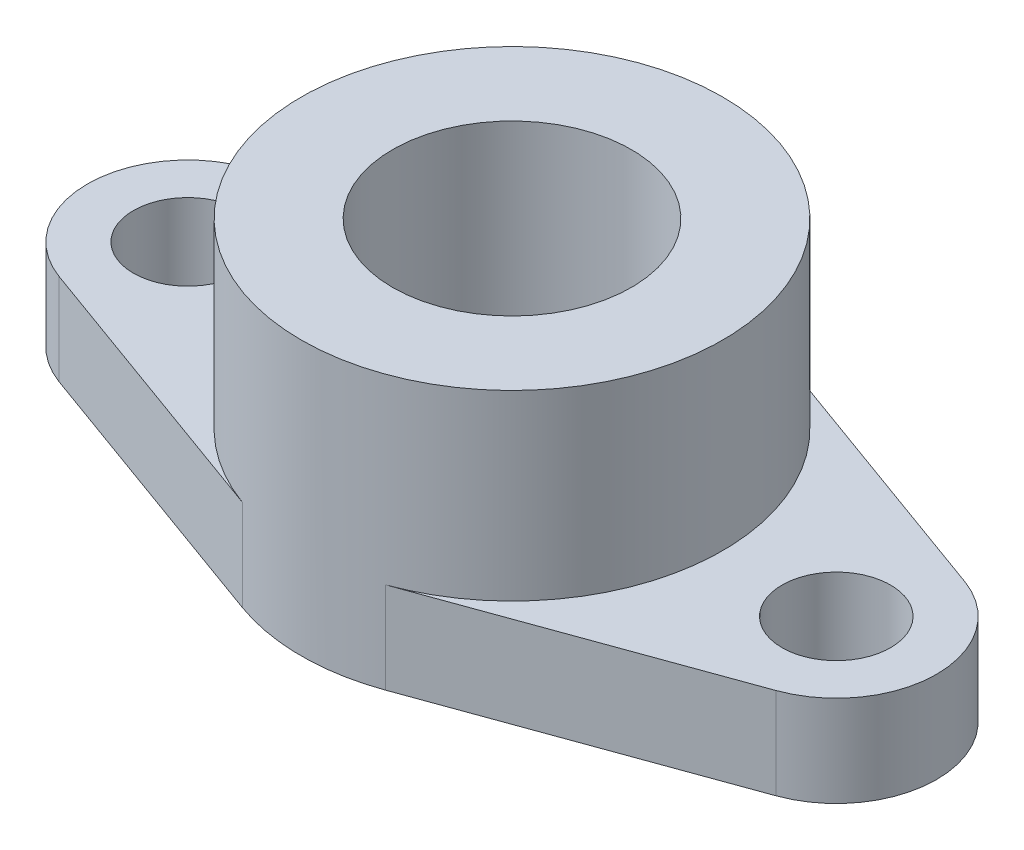
from build123d import *

# Parameters (mm, degrees)
SKETCH1_R           = 4.826
SKETCH1_R_2         = 2.9765625
BOSS_EXTRUDE1_DEPTH = 5
SKETCH2_R           = 11.548437406
SKETCH2_R_2         = 6.5484375
BOSS_EXTRUDE2_DEPTH = 10.000000066


with BuildPart() as part:
    # Sketch1 → Boss-Extrude1 (new body)
    with BuildSketch(Plane(origin=(0, 0, 0), x_dir=(1, 0, 0), z_dir=(0, 1, 0))):
        with BuildLine():
            Line((19.651001449, 5.171977776), (3.928571441, 10.859683833))
            ThreePointArc((3.928571441, 10.859683833), (0, 11.548437406), (-3.928571441, 10.859683833))
            Line((-3.928571441, 10.859683833), (-19.651001449, 5.171977776))
            ThreePointArc((-19.651001449, 5.171977776), (-23.280000049, 0), (-19.651001449, -5.171977776))
            Line((-19.651001449, -5.171977776), (-3.928571441, -10.859683833))
            ThreePointArc((-3.928571441, -10.859683833), (0, -11.548437406), (3.928571441, -10.859683833))
            Line((3.928571441, -10.859683833), (19.651001449, -5.171977776))
            ThreePointArc((19.651001449, -5.171977776), (23.280000049, 0), (19.651001449, 5.171977776))
        make_face()
        Circle(SKETCH1_R, mode=Mode.SUBTRACT)
        with Locations((17.78, 0)):
            Circle(SKETCH1_R_2, mode=Mode.SUBTRACT)
        with Locations((-17.78, 0)):
            Circle(SKETCH1_R_2, mode=Mode.SUBTRACT)
    extrude(amount=BOSS_EXTRUDE1_DEPTH)

    # Sketch2 → Boss-Extrude2 (add)
    with BuildSketch(Plane(origin=(0, 5, 0), x_dir=(1, 0, 0), z_dir=(0, 1, 0))):
        Circle(SKETCH2_R)
        Circle(SKETCH2_R_2, mode=Mode.SUBTRACT)
    extrude(amount=BOSS_EXTRUDE2_DEPTH)


solid = part.part
